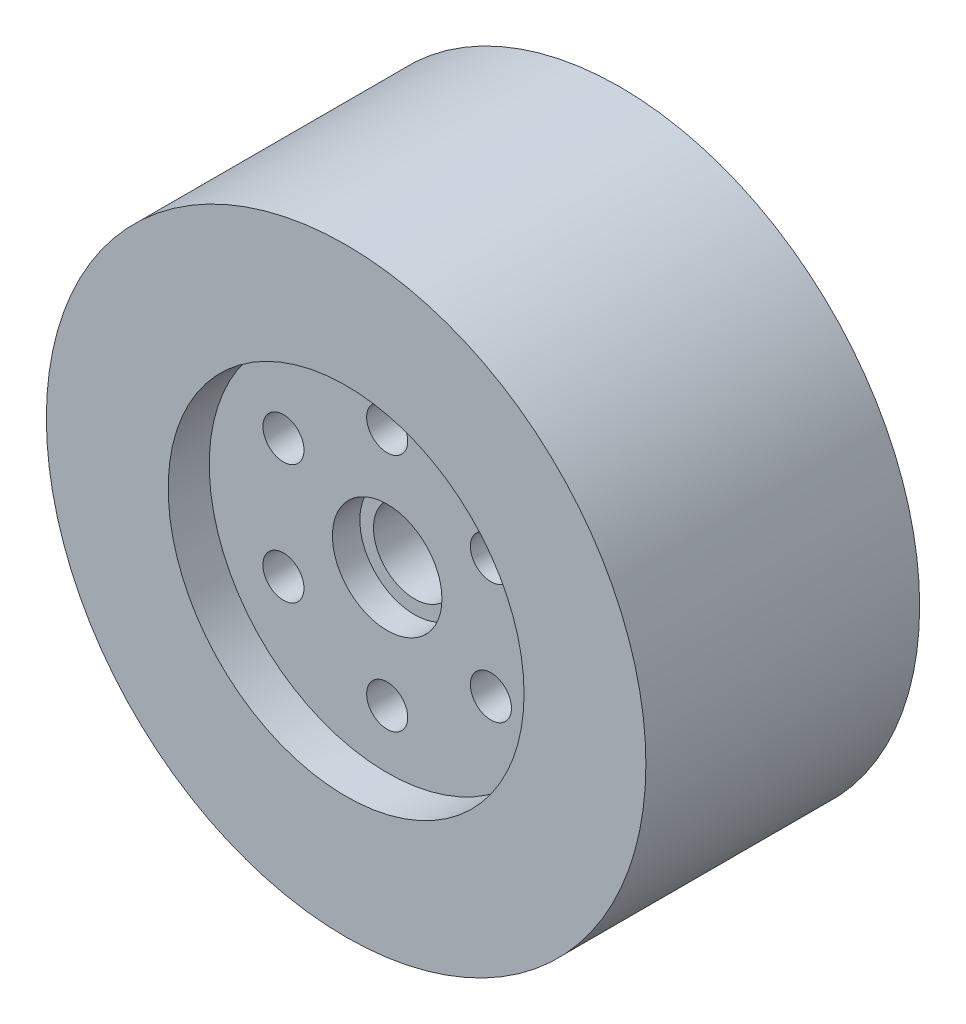
from build123d import *

# Parameters (mm, degrees)
SKETCH1_R           = 21.9
BOSS_EXTRUDE1_DEPTH = 20
SKETCH2_R           = 3
CUT_EXTRUDE1_DEPTH  = 37.867600953
SKETCH4_R           = 4
CUT_EXTRUDE4_DEPTH  = 2
SKETCH6_R           = 13
CUT_EXTRUDE6_DEPTH  = 3
SKETCH9_R           = 1.5
CUT_EXTRUDE7_DEPTH  = 5
CUT_EXTRUDE8_START  = -5
SKETCH3_R           = 4
CUT_EXTRUDE8_DEPTH  = 5
CIRPATTERN1_COUNT   = 6


with BuildPart() as part:
    # Sketch1 → Boss-Extrude1 (new body)
    with BuildSketch(Plane.XY):
        Circle(SKETCH1_R)
    extrude(amount=BOSS_EXTRUDE1_DEPTH)

    # Sketch2 → Cut-Extrude1 (cut, through all)
    with BuildSketch(Plane.XY.offset(20)):
        Circle(SKETCH2_R)
    extrude(amount=-CUT_EXTRUDE1_DEPTH, mode=Mode.SUBTRACT)

    # Sketch4 → Cut-Extrude4 (cut)
    with BuildSketch(Plane(origin=(0, 0, 0), x_dir=(-1, 0, 0), z_dir=(0, 0, -1))):
        Circle(SKETCH4_R)
    extrude(amount=-CUT_EXTRUDE4_DEPTH, mode=Mode.SUBTRACT)

    # Sketch6 → Cut-Extrude6 (cut)
    with BuildSketch(Plane.XY.offset(20)):
        Circle(SKETCH6_R)
    extrude(amount=-CUT_EXTRUDE6_DEPTH, mode=Mode.SUBTRACT)

    # Sketch9 → Cut-Extrude7 (cut)
    with BuildSketch(Plane.XY.offset(17)):
        with Locations((0, 8.75)):
            Circle(SKETCH9_R)
    cut_extrude7 = extrude(amount=-CUT_EXTRUDE7_DEPTH, mode=Mode.SUBTRACT)

    # Sketch3 → Cut-Extrude8 (cut)
    with BuildSketch(Plane.XY.offset(20).offset(CUT_EXTRUDE8_START)):
        Circle(SKETCH3_R)
    extrude(amount=CUT_EXTRUDE8_DEPTH, mode=Mode.SUBTRACT)

    # CirPattern1: Cut-Extrude7 ×6 about axis
    cirpattern1_axis = Axis((0, 0, 17), (0, 0, 1))
    for i in range(1, CIRPATTERN1_COUNT):
        add(cut_extrude7.rotate(cirpattern1_axis, i * 360 / CIRPATTERN1_COUNT), mode=Mode.SUBTRACT)


solid = part.part
